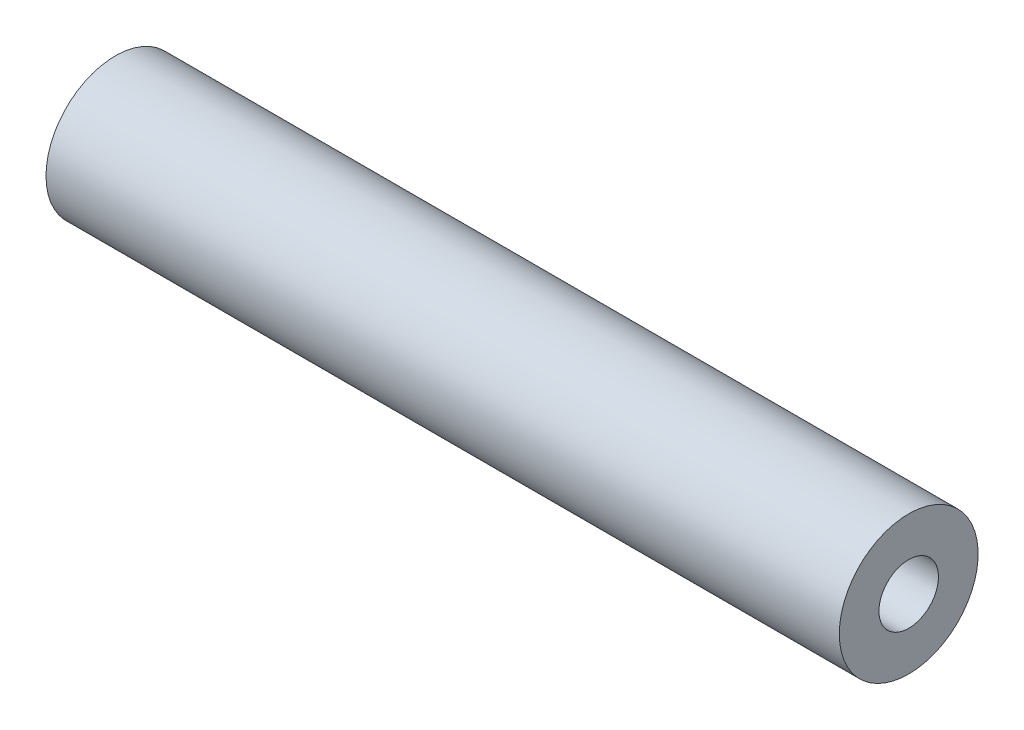
from build123d import *

# Parameters (mm, degrees)
SKETCH1_W = 200
SKETCH1_H = 10


with BuildPart() as part:
    # Sketch1 → Revolve1 (revolve)
    with BuildSketch(Plane.XY):
        with Locations((120, 12.5)):
            Rectangle(SKETCH1_W, SKETCH1_H)
    revolve(axis=Axis((0, 0, 0), (1, 0, 0)))


solid = part.part
